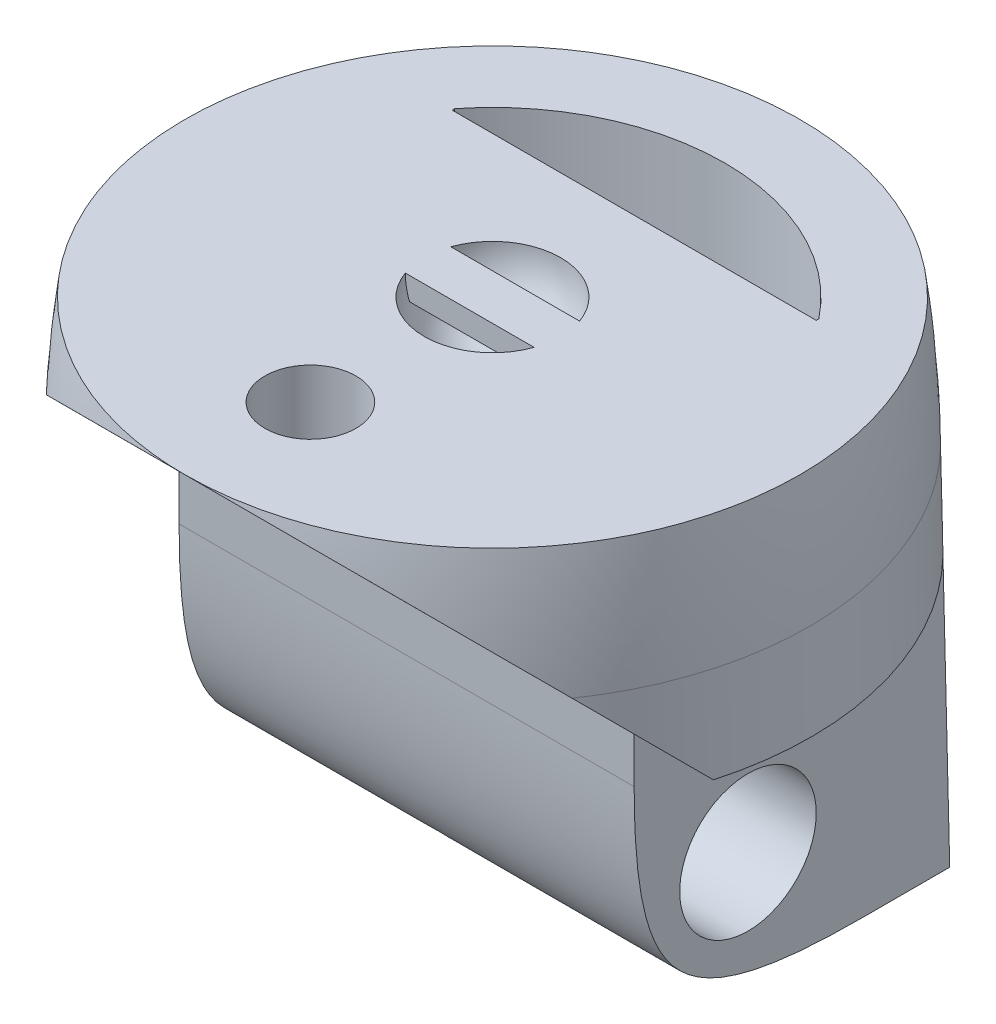
from build123d import *
from build123d.topology import SkipClean

# Parameters (mm, degrees)
SKETCH1_R                     = 7
BOSS_EXTRUDE1_DEPTH           = 12
BOSS_EXTRUDE1_TAPER           = 1
BOSS_EXTRUDE1_OTHER_WAY_DEPTH = 6
BOSS_EXTRUDE1_OTHER_WAY_TAPER = -1
CUT_EXTRUDE1_DEPTH            = 16.651018747
CUT_EXTRUDE1_DEPTH_BACK       = 16.651018747
CUT_EXTRUDE2_START            = -8.990788257
CUT_EXTRUDE2_OUTLINE_W        = 6.502745185
CUT_EXTRUDE2_OUTLINE_H        = 6
CUT_EXTRUDE2_DEPTH            = 8.990788257
SKETCH5_R                     = 1.5
CUT_EXTRUDE3_DEPTH            = 19.397749866
FILLET1_SIZE                  = 5
CUT_EXTRUDE4_DEPTH            = 16.60375593
CUT_EXTRUDE4_DEPTH_BACK       = 16.60375593
SKETCH6_W                     = 14.945158024
SKETCH6_H                     = 10.867310448
CUT_EXTRUDE5_DEPTH            = 15.755048084
SKETCH8_R                     = 1
CUT_EXTRUDE6_DEPTH            = 15.755048081
BOSS_EXTRUDE2_DEPTH           = 0.5


with BuildPart() as part:
    # Sketch1 → Boss-Extrude1 (new body)
    with BuildSketch(Plane(origin=(0, 0, 0), x_dir=(1, 0, 0), z_dir=(0, 1, 0))):
        Circle(SKETCH1_R)
    extrude(amount=BOSS_EXTRUDE1_DEPTH, taper=BOSS_EXTRUDE1_TAPER)

    # Sketch1 → Boss-Extrude1 other way (add)
    with BuildSketch(Plane(origin=(0, 0, 0), x_dir=(1, 0, 0), z_dir=(0, 1, 0))):
        Circle(SKETCH1_R)
    extrude(amount=-BOSS_EXTRUDE1_OTHER_WAY_DEPTH, taper=BOSS_EXTRUDE1_OTHER_WAY_TAPER)

    # Sketch3 → Cut-Extrude1 (cut, two sides: drawn at the far end of the back side and taken through both)
    with BuildSketch(Plane(origin=(0, 0, 0), x_dir=(0, 0, -1), z_dir=(1, 0, 0)).offset(-CUT_EXTRUDE1_DEPTH_BACK)):
        Polygon((-1.886057768, -6), (-1.886057768, 0), (-9.929766736, 8.043708969), (-9.929766736, -6), align=None)
    extrude(amount=CUT_EXTRUDE1_DEPTH + CUT_EXTRUDE1_DEPTH_BACK, mode=Mode.SUBTRACT)

    # Cut-Extrude2: read off the stored shape, not the designer's step
    # Cut-Extrude2 outline → Cut-Extrude2 (cut)
    with BuildSketch(Plane.XY.offset(1.886057768).offset(CUT_EXTRUDE2_START)):
        with Locations((-8.251372593, -3)):
            Rectangle(CUT_EXTRUDE2_OUTLINE_W, CUT_EXTRUDE2_OUTLINE_H)
        with Locations((8.251372593, -3)):
            Rectangle(CUT_EXTRUDE2_OUTLINE_W, CUT_EXTRUDE2_OUTLINE_H)
    extrude(amount=CUT_EXTRUDE2_DEPTH, mode=Mode.SUBTRACT)

    # Sketch5 → Cut-Extrude3 (cut, through all)
    with BuildSketch(Plane(origin=(5, 0, 0), x_dir=(0, 0, -1), z_dir=(1, 0, 0))):
        with Locations((0.613942232, -3.5)):
            Circle(SKETCH5_R)
    extrude(amount=-CUT_EXTRUDE3_DEPTH, mode=Mode.SUBTRACT)

    # Fillet1
    # a fillet whose section is not a circle: 5 mm, written as the material it takes off along each edge
    with BuildSketch(Plane(origin=(17.5, -6, 1.886057768), x_dir=(0, 0, -1), z_dir=(-1, 0, 0))) as fillet1_piece_1:
        with BuildLine():
            Bezier((FILLET1_SIZE, 0), (0, 0), (0, -FILLET1_SIZE), weights=[1, 1.5, 1])
            Line((0, -FILLET1_SIZE), (0, 0))
            Line((0, 0), (FILLET1_SIZE, 0))
        make_face()
    extrude(amount=35, mode=Mode.SUBTRACT)

    # Fillet2
    # a fillet whose section is not a circle: 10, 5 mm, written as the material it takes off along each edge
    with BuildSketch(Plane(origin=(0, 12, 0), x_dir=(1, 0, 0), z_dir=(0, 0, -1))) as fillet2_piece_1:
        with BuildLine():
            Bezier((6.963566706, 9.912737968), (6.790539221, 0), (1.96432823, 0), weights=[1, 0.818181818, 1])
            Line((1.96432823, 0), (6.790539221, 0))
            Line((6.790539221, 0), (6.963566706, 9.912737968))
        make_face()
    revolve(axis=Axis((0, 12, 0), (0, -1, 0)), mode=Mode.SUBTRACT)

    # Sketch6 → Cut-Extrude4 (cut, two sides: drawn at the far end of the back side and taken through both)
    with SkipClean():  # the faces are left unmerged after this step: merging them gives an invalid solid
        with BuildSketch(Plane(origin=(0, 0, 0), x_dir=(0, 0, -1), z_dir=(1, 0, 0)).offset(-CUT_EXTRUDE4_DEPTH_BACK)):
            with Locations((0.712964096, 10.307212369)):
                Rectangle(SKETCH6_W, SKETCH6_H)
        extrude(amount=CUT_EXTRUDE4_DEPTH + CUT_EXTRUDE4_DEPTH_BACK, mode=Mode.SUBTRACT)
    add(part.part.scale(1), mode=Mode.REPLACE)  # the faces are merged on a copy

    # Sketch7 → Cut-Extrude5 (cut, through all)
    with BuildSketch(Plane.XZ.offset(6)):
        with BuildLine():
            Line((4, -3.113942232), (4, -3.171477944))
            ThreePointArc((4, -3.171477944), (0, -5.10473039), (-4, -3.171477944))
            Line((-4, -3.171477944), (-4, -3.113942232))
            Line((-4, -3.113942232), (4, -3.113942232))
        make_face()
    extrude(amount=-CUT_EXTRUDE5_DEPTH, mode=Mode.SUBTRACT)

    # Sketch8 → Cut-Extrude6 (cut, through all)
    with BuildSketch(Plane(origin=(0, 4.873557145, 0), x_dir=(1, 0, 0), z_dir=(0, 1, 0))):
        with Locations(Location((0, -4, 0), (0, 0, 270))):
            Circle(SKETCH8_R)
    extrude(amount=-CUT_EXTRUDE6_DEPTH, mode=Mode.SUBTRACT)

    # Sketch9 → Cut-Revolve1 (revolve, cut)
    with BuildSketch(Plane(origin=(0, 4.873557145, 0), x_dir=(1, 0, 0), z_dir=(0, 1, 0))):
        with BuildLine():
            Line((-1.5, 0), (1.5, 0))
            ThreePointArc((1.5, 0), (0, 1.5), (-1.5, 0))
        make_face()
    revolve(axis=Axis((-1.5, 4.873557145, 0), (1, 0, 0)), mode=Mode.SUBTRACT)

    # Sketch10 → Boss-Extrude2 (add)
    with BuildSketch(Plane(origin=(0, 4.873557145, 0), x_dir=(1, 0, 0), z_dir=(0, 1, 0))):
        with BuildLine():
            Line((1.414213562, 0.5), (-1.414213562, 0.5))
            ThreePointArc((-1.414213562, 0.5), (-1.5, 0), (-1.414213562, -0.5))
            Line((-1.414213562, -0.5), (1.414213562, -0.5))
            ThreePointArc((1.414213562, -0.5), (1.478397839, -0.253652968), (1.5, 0))
            ThreePointArc((1.5, 0), (1.478397839, 0.253652968), (1.414213562, 0.5))
        make_face()
    extrude(amount=-BOSS_EXTRUDE2_DEPTH)


solid = part.part
